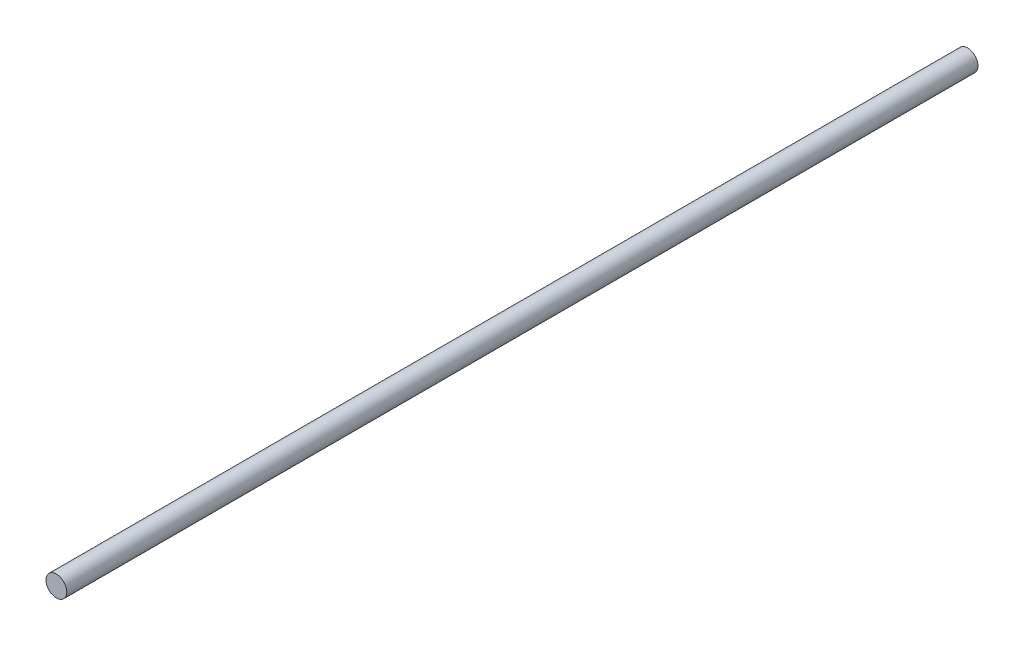
from build123d import *

# Parameters (mm, degrees)
SKETCH2_W = 350.60000095
SKETCH2_H = 4


with BuildPart() as part:
    # Sketch2 → Revolve1 (revolve)
    with BuildSketch(Plane(origin=(0, 0, 0), x_dir=(0, 0, -1), z_dir=(1, 0, 0))):
        with Locations((156.200000001, 2)):
            Rectangle(SKETCH2_W, SKETCH2_H)
    revolve(axis=Axis((0, 0, 19.100000474), (0, 0, -1)))


solid = part.part
